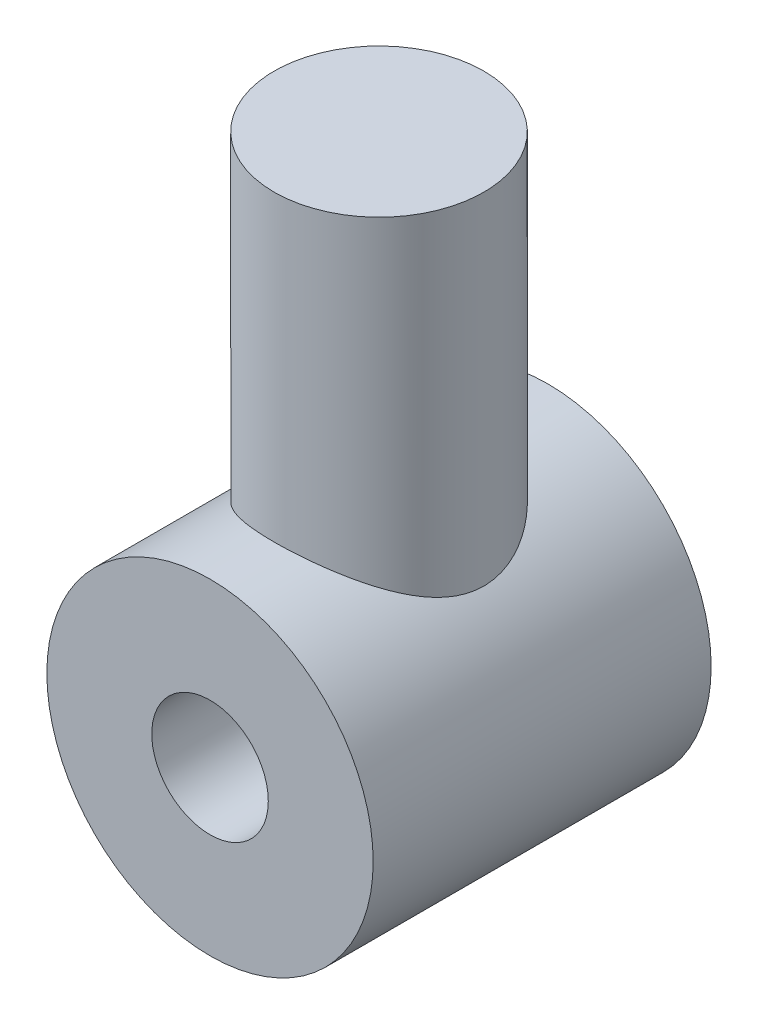
from build123d import *

# Parameters (mm, degrees)
SKETCH1_R           = 14
BOSS_EXTRUDE1_DEPTH = 29
SKETCH2_R           = 9
BOSS_EXTRUDE2_DEPTH = 40
SKETCH3_R           = 5
CUT_EXTRUDE1_DEPTH  = 52.351728468


with BuildPart() as part:
    # Sketch1 → Boss-Extrude1 (new body)
    with BuildSketch(Plane.XY):
        Circle(SKETCH1_R)
    extrude(amount=BOSS_EXTRUDE1_DEPTH)

    # Sketch2 → Boss-Extrude2 (add)
    with BuildSketch(Plane(origin=(0, 0, 0), x_dir=(1, 0, 0), z_dir=(0, 1, 0))):
        with Locations((0, -14.5)):
            Circle(SKETCH2_R)
    extrude(amount=BOSS_EXTRUDE2_DEPTH)

    # Sketch3 → Cut-Extrude1 (cut, through all)
    with BuildSketch(Plane.XY.offset(29)):
        Circle(SKETCH3_R)
    extrude(amount=-CUT_EXTRUDE1_DEPTH, mode=Mode.SUBTRACT)


solid = part.part
